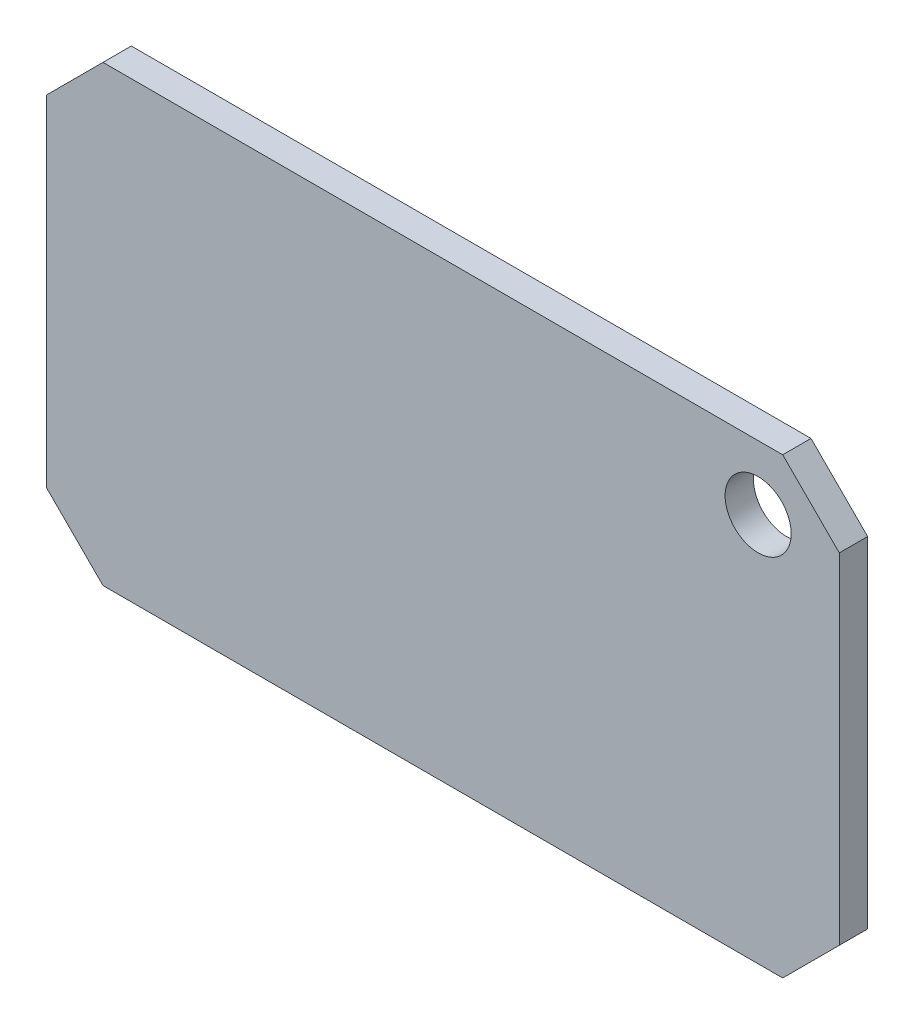
from build123d import *

# Parameters (mm, degrees)
SKETCH1_R           = 1.75
BOSS_EXTRUDE1_DEPTH = 1.5


with BuildPart() as part:
    # Sketch1 → Boss-Extrude1 (new body)
    with BuildSketch(Plane.XY):
        Polygon((-21, 9), (-18, 12), (18, 12), (21, 9), (21, -9), (18, -12), (-18, -12), (-21, -9), align=None)
        with Locations((16.7, 8.6)):
            Circle(SKETCH1_R, mode=Mode.SUBTRACT)
    extrude(amount=BOSS_EXTRUDE1_DEPTH)


solid = part.part
